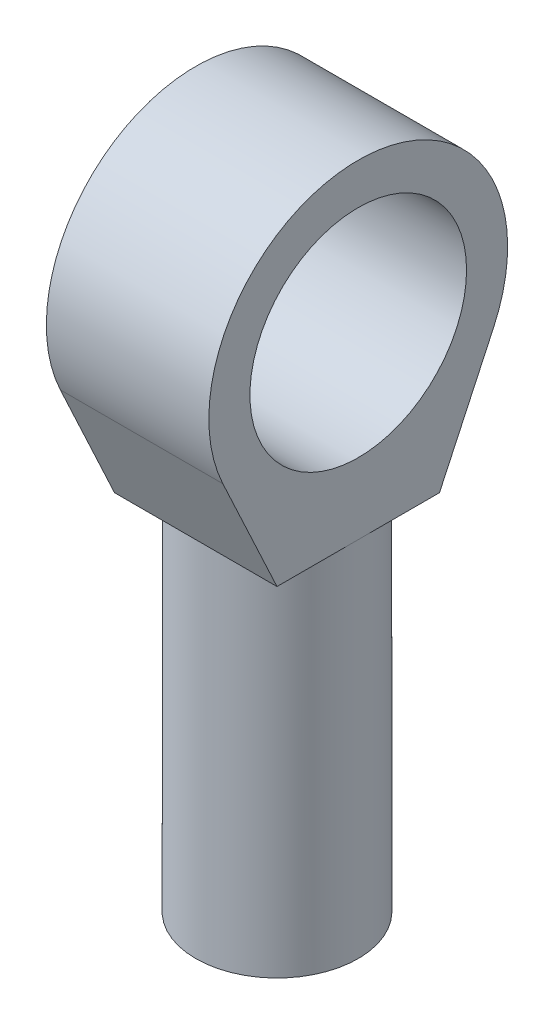
from build123d import *

# Parameters (mm, degrees)
SKETCH2_R                = 9.525
BOSS_EXTRUDE1_DEPTH      = 42.545
BOSS_EXTRUDE2_DEPTH      = 9.525
BOSS_EXTRUDE2_DEPTH_BACK = 9.525
SKETCH3_R                = 12.7


with BuildPart() as part:
    # Sketch2 → Boss-Extrude1 (new body)
    with BuildSketch(Plane(origin=(0, 0, 0), x_dir=(1, 0, 0), z_dir=(0, 1, 0))):
        Circle(SKETCH2_R)
    extrude(amount=BOSS_EXTRUDE1_DEPTH)

    # Sketch3 → Boss-Extrude2 (add, two sides: drawn at the far end of the back side and taken through both)
    with BuildSketch(Plane(origin=(0, 0, 0), x_dir=(0, 0, -1), z_dir=(1, 0, 0)).offset(-BOSS_EXTRUDE2_DEPTH_BACK)):
        with BuildLine():
            Line((-9.525, 42.545), (-15.875, 56.162618945))
            ThreePointArc((-15.875, 56.162618945), (0, 81.081377482), (15.875, 56.162618945))
            Line((15.875, 56.162618945), (9.525, 42.545))
            Line((9.525, 42.545), (-9.525, 42.545))
        make_face()
        with Locations((0, 63.565253018)):
            Circle(SKETCH3_R, mode=Mode.SUBTRACT)
    extrude(amount=BOSS_EXTRUDE2_DEPTH + BOSS_EXTRUDE2_DEPTH_BACK)


solid = part.part
